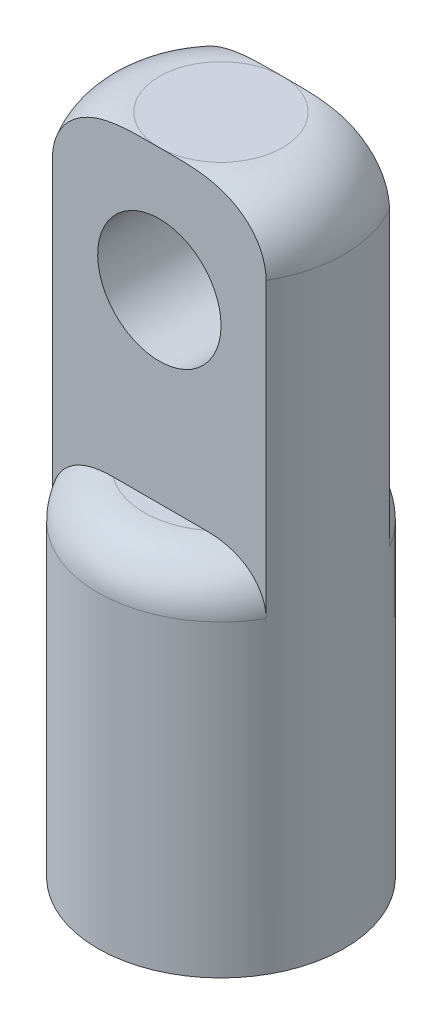
from build123d import *

# Parameters (mm, degrees)
SKETCH_1_R          = 8
EXTRUDE_1_DEPTH     = 43
SKETCH_2_W          = 4
SKETCH_2_H          = 20
CUT_EXTRUDE_1_DEPTH = 21.5
FILLET_1_R          = 3
FILLET_2_R          = 4
SKETCH_3_R          = 4
CUT_EXTRUDE_2_DEPTH = 21.5
SKETCH_4_R          = 4
CUT_EXTRUDE_3_DEPTH = 20


with BuildPart() as part:
    # 草图1 → 凸台-拉伸1 (new body)
    with BuildSketch(Plane(origin=(0, 0, 0), x_dir=(1, 0, 0), z_dir=(0, 1, 0))):
        with Locations(Location((0, 0, 0), (0, 0, 270))):
            Circle(SKETCH_1_R)
    extrude(amount=EXTRUDE_1_DEPTH)

    # 草图2 → 切除-拉伸1 (cut, symmetric)
    with BuildSketch(Plane(origin=(0, 0, 0), x_dir=(0, 0, -1), z_dir=(1, 0, 0))):
        with Locations((-6, 33)):
            Rectangle(SKETCH_2_W, SKETCH_2_H)
        with Locations((6, 33)):
            Rectangle(SKETCH_2_W, SKETCH_2_H)
    extrude(amount=CUT_EXTRUDE_1_DEPTH, both=True, mode=Mode.SUBTRACT)

    # 圆角1
    fillet_1_edges = [part.edges().sort_by_distance(p)[0] for p in [
        (-4, 23, 6.92820323),
        (0, 23, -8),
    ]]
    fillet(fillet_1_edges, radius=FILLET_1_R)

    # 圆角2
    fillet_2_edges = [part.edges().sort_by_distance(p)[0] for p in [
        (8, 43, 0),
        (-8, 43, 0),
    ]]
    fillet(fillet_2_edges, radius=FILLET_2_R - 0.0001)  # a hair under: the kernel refuses the full size

    # 草图3 → 切除-拉伸2 (cut, symmetric)
    with BuildSketch(Plane.XY.offset(4)):
        with Locations(Location((0, 35, 0), (0, 0, 90))):
            Circle(SKETCH_3_R)
    extrude(amount=CUT_EXTRUDE_2_DEPTH, both=True, mode=Mode.SUBTRACT)

    # 草图4 → 切除-拉伸3 (cut)
    with BuildSketch(Plane.XZ):
        with Locations(Location((0, 0, 0), (0, 0, 270))):
            Circle(SKETCH_4_R)
    extrude(amount=-CUT_EXTRUDE_3_DEPTH, mode=Mode.SUBTRACT)


solid = part.part
